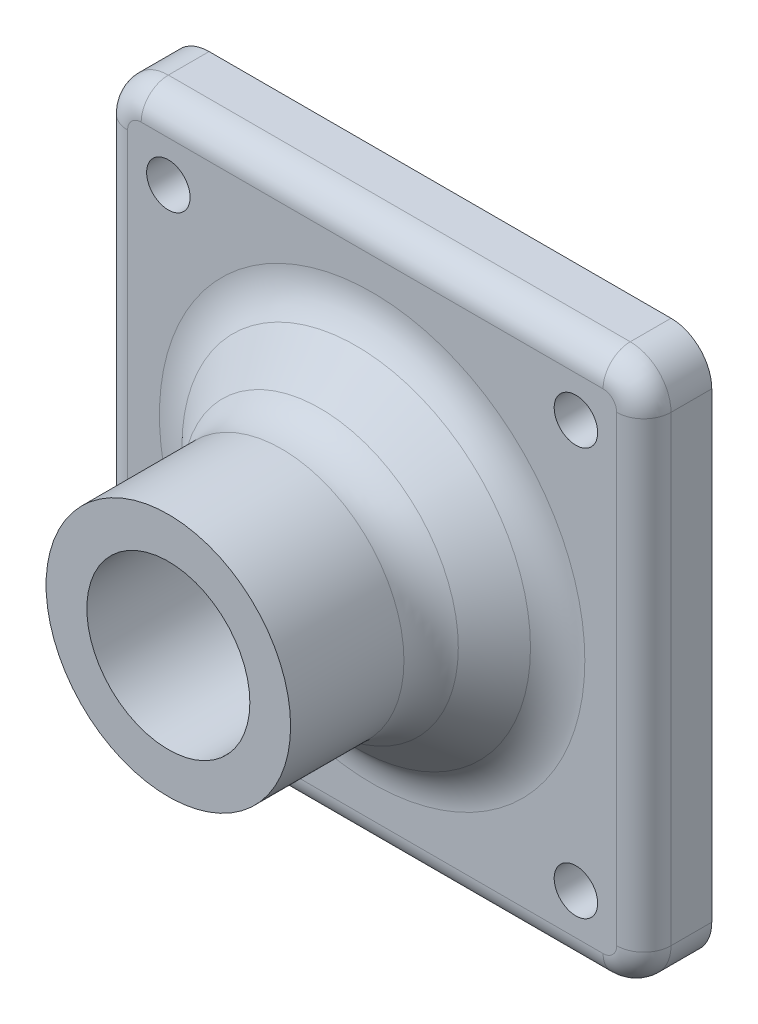
from build123d import *

# Parameters (mm, degrees)
SKETCH2_R           = 9
SKETCH2_R_2         = 6
BOSS_EXTRUDE1_DEPTH = 20
SKETCH3_R           = 6
BOSS_EXTRUDE2_DEPTH = 5
FILLET1_R           = 2
CUT_EXTRUDE1_REACH  = 188.327
SKETCH4_R           = 1.6
CHAMFER1_SIZE       = 5
FILLET2_R           = 4


with BuildPart() as part:
    # Sketch2 → Boss-Extrude1 (new body)
    with BuildSketch(Plane.XY):
        with Locations((-135, -82.312657819)):
            Circle(SKETCH2_R)
        with Locations((-135, -82.312657819)):
            Circle(SKETCH2_R_2, mode=Mode.SUBTRACT)
    extrude(amount=BOSS_EXTRUDE1_DEPTH)

    # Sketch3 → Boss-Extrude2 (add)
    with BuildSketch(Plane(origin=(0, 0, 0), x_dir=(-1, 0, 0), z_dir=(0, 0, -1))):
        with BuildLine():
            Line((152, -102.312657819), (118, -102.312657819))
            ThreePointArc((118, -102.312657819), (115.878679656, -101.433978162), (115, -99.312657819))
            Line((115, -99.312657819), (115, -65.312657819))
            ThreePointArc((115, -65.312657819), (115.878679656, -63.191337475), (118, -62.312657819))
            Line((118, -62.312657819), (152, -62.312657819))
            ThreePointArc((152, -62.312657819), (154.121320344, -63.191337475), (155, -65.312657819))
            Line((155, -65.312657819), (155, -99.312657819))
            ThreePointArc((155, -99.312657819), (154.121320344, -101.433978162), (152, -102.312657819))
        make_face()
        with Locations((135, -82.312657819)):
            Circle(SKETCH3_R, mode=Mode.SUBTRACT)
    extrude(amount=-BOSS_EXTRUDE2_DEPTH)

    # Fillet1
    fillet1_edges = [part.edges().sort_by_distance(p)[0] for p in [
        (-154.121320344, -101.433978162, 5),
        (-135, -102.312657819, 5),
        (-115.878679656, -101.433978162, 5),
        (-115, -82.312657819, 5),
        (-115.878679656, -63.191337475, 5),
        (-135, -62.312657819, 5),
        (-154.121320344, -63.191337475, 5),
        (-155, -82.312657819, 5),
    ]]
    fillet(fillet1_edges, radius=FILLET1_R)

    # Sketch4 → Cut-Extrude1 (cut, up to next)
    with BuildSketch(Plane.XY.offset(5), mode=Mode.PRIVATE) as cut_extrude1_sk1:
        with Locations((-150, -67.312657819)):
            Circle(SKETCH4_R)
    cut_extrude1_tool1 = extrude(cut_extrude1_sk1.sketch, amount=-CUT_EXTRUDE1_REACH, mode=Mode.PRIVATE) & part.part
    # Sketch4 → Cut-Extrude1 (cut, up to next)
    with BuildSketch(Plane.XY.offset(5), mode=Mode.PRIVATE) as cut_extrude1_sk2:
        with Locations((-120, -67.312657819)):
            Circle(SKETCH4_R)
    cut_extrude1_tool2 = extrude(cut_extrude1_sk2.sketch, amount=-CUT_EXTRUDE1_REACH, mode=Mode.PRIVATE) & part.part
    # Sketch4 → Cut-Extrude1 (cut, up to next)
    with BuildSketch(Plane.XY.offset(5), mode=Mode.PRIVATE) as cut_extrude1_sk3:
        with Locations((-120, -97.312657819)):
            Circle(SKETCH4_R)
    cut_extrude1_tool3 = extrude(cut_extrude1_sk3.sketch, amount=-CUT_EXTRUDE1_REACH, mode=Mode.PRIVATE) & part.part
    # Sketch4 → Cut-Extrude1 (cut, up to next)
    with BuildSketch(Plane.XY.offset(5), mode=Mode.PRIVATE) as cut_extrude1_sk4:
        with Locations((-150, -97.312657819)):
            Circle(SKETCH4_R)
    cut_extrude1_tool4 = extrude(cut_extrude1_sk4.sketch, amount=-CUT_EXTRUDE1_REACH, mode=Mode.PRIVATE) & part.part
    add(cut_extrude1_tool1.solids().sort_by_distance((-150, -67.312658, 5))[0], mode=Mode.SUBTRACT)
    add(cut_extrude1_tool2.solids().sort_by_distance((-120, -67.312658, 5))[0], mode=Mode.SUBTRACT)
    add(cut_extrude1_tool3.solids().sort_by_distance((-120, -97.312658, 5))[0], mode=Mode.SUBTRACT)
    add(cut_extrude1_tool4.solids().sort_by_distance((-150, -97.312658, 5))[0], mode=Mode.SUBTRACT)

    # Chamfer1
    chamfer1_edges = [part.edges().sort_by_distance(p)[0] for p in [
        (-144, -82.312657819, 5),
    ]]
    chamfer(chamfer1_edges, length=CHAMFER1_SIZE)

    # Fillet2
    fillet2_edges = [part.edges().sort_by_distance(p)[0] for p in [
        (-144, -82.312657819, 10),
        (-149, -82.312657819, 5),
    ]]
    fillet(fillet2_edges, radius=FILLET2_R)


solid = part.part
